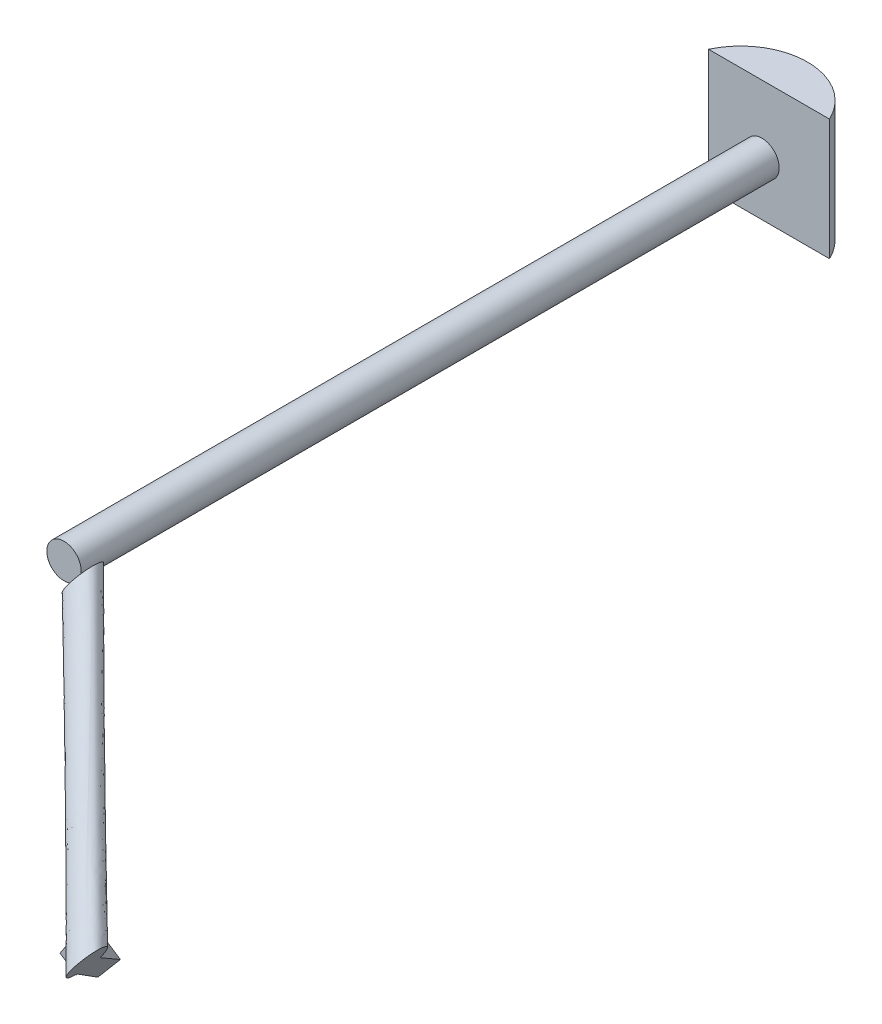
from build123d import *

# Parameters (mm, degrees)
BOSS_EXTRUDE1_DEPTH      = 58.596630013
BOSS_EXTRUDE1_DEPTH_BACK = 14.702178577
SKETCH1_R                = 1.802945267
BOSS_EXTRUDE2_DEPTH      = 6.35
BOSS_EXTRUDE4_DEPTH      = 2.032


with BuildPart() as part:
    # Sketch1 → Boss-Extrude1 (new, two sides: drawn at the far end of the back side and taken through both)
    with BuildSketch(Plane.XY.offset(-BOSS_EXTRUDE1_DEPTH_BACK)):
        Circle(SKETCH1_R)
    extrude(amount=BOSS_EXTRUDE1_DEPTH + BOSS_EXTRUDE1_DEPTH_BACK)


with BuildPart() as body_2:
    # Sketch2 → Boss-Extrude2 (new, symmetric)
    with BuildSketch(Plane(origin=(0, 0, -18.001846855), x_dir=(1, 0, 0), z_dir=(0, 1, 0))):
        with BuildLine():
            Line((-6.35, -2.563701192), (0, -2.563701192))
            Line((0, -2.563701192), (6.35, -2.563701192))
            ThreePointArc((6.35, -2.563701192), (0, 1.474189404), (-6.35, -2.563701192))
        make_face()
    extrude(amount=BOSS_EXTRUDE2_DEPTH, both=True)


with BuildPart() as body_3:
    # Loft1: read off the stored shape, not the designer's step
    # Loft1: loft between two sections, ruled curve by curve
    loft1_from = [
        Edge.make_bspline([(23.758910272, -13.385525744, 78.896242126), (23.758910272, -13.385525744, 78.73686213), (23.748236498, -13.401702223, 78.556571478), (23.685317405, -13.497058312, 78.164879199), (23.632510309, -13.577089315, 77.952712548), (23.463977025, -13.83250741, 77.544699757), (23.347053414, -14.009709237, 77.34987012), (23.055473338, -14.451609055, 77.067508327), (22.881132751, -14.715828321, 76.98368217), (22.530021742, -15.247949351, 76.98368217), (22.355681154, -15.512168617, 77.067508327), (22.064101078, -15.954068435, 77.34987012), (21.947177467, -16.131270262, 77.544699757), (21.778644183, -16.386688357, 77.952712548), (21.725837088, -16.46671936, 78.164879199), (21.662917995, -16.562075449, 78.556571478), (21.65224422, -16.578251928, 78.73686213), (21.65224422, -16.578251928, 79.055622122), (21.662917995, -16.562075449, 79.235912774), (21.725837088, -16.46671936, 79.627605053), (21.778644183, -16.386688357, 79.839771704), (21.947177467, -16.131270262, 80.247784495), (22.064101078, -15.954068435, 80.442614132), (22.355681154, -15.512168617, 80.724975925), (22.530021742, -15.247949351, 80.808802082), (22.881132751, -14.715828321, 80.808802082), (23.055473338, -14.451609055, 80.724975925), (23.347053414, -14.009709237, 80.442614132), (23.463977025, -13.83250741, 80.247784495), (23.632510309, -13.577089315, 79.839771704), (23.685317405, -13.497058312, 79.627605053), (23.748236498, -13.401702223, 79.235912774), (23.758910272, -13.385525744, 79.055622122), (23.758910272, -13.385525744, 78.896242126)], [0, 0, 0, 0, 0.0625, 0.0625, 0.125, 0.125, 0.1875, 0.1875, 0.25, 0.25, 0.3125, 0.3125, 0.375, 0.375, 0.4375, 0.4375, 0.5, 0.5, 0.5625, 0.5625, 0.625, 0.625, 0.6875, 0.6875, 0.75, 0.75, 0.8125, 0.8125, 0.875, 0.875, 0.9375, 0.9375, 1, 1, 1, 1], 3),
    ]
    loft1_to = [
        Edge.make_bspline([(2.353128009, 0.292600514, 56.97921639), (2.30108837, 0.213732618, 56.850866422), (2.233625455, 0.111490208, 56.717166863), (2.055063597, -0.159126542, 56.469464069), (1.943262459, -0.328565082, 56.355449486), (1.6743198, -0.736157101, 56.208293442), (1.516545887, -0.975268991, 56.17725956), (1.189539359, -1.470858837, 56.263746597), (1.02177118, -1.725117388, 56.383911953), (0.739018716, -2.15363865, 56.761870025), (0.625991196, -2.324935817, 57.017047112), (0.483374254, -2.541076787, 57.558310506), (0.452829155, -2.587368953, 57.84107231), (0.450329449, -2.591157347, 58.351068102), (0.477078646, -2.550618002, 58.578772473), (0.554302021, -2.433583272, 58.961935441), (0.604573586, -2.357394955, 59.11861485), (0.708652864, -2.199659164, 59.375314785), (0.776115778, -2.097416754, 59.509014344), (0.954677637, -1.826800004, 59.756717138), (1.066478775, -1.657361463, 59.870731722), (1.335421433, -1.249769445, 60.017887765), (1.493195346, -1.010657554, 60.048921647), (1.820201874, -0.515067708, 59.962434611), (1.987970053, -0.260809157, 59.842269254), (2.270722517, 0.167712105, 59.464311182), (2.383750038, 0.339009271, 59.209134095), (2.52636698, 0.555150241, 58.667870701), (2.556912078, 0.601442408, 58.385108897), (2.559411785, 0.605230801, 57.875113105), (2.532662588, 0.564691456, 57.647408734), (2.455439213, 0.447656726, 57.264245767), (2.405167648, 0.371468409, 57.107566358), (2.353128009, 0.292600514, 56.97921639)], [0, 0, 0, 0, 0.0625, 0.0625, 0.125, 0.125, 0.1875, 0.1875, 0.25, 0.25, 0.3125, 0.3125, 0.375, 0.375, 0.4375, 0.4375, 0.5, 0.5, 0.5625, 0.5625, 0.625, 0.625, 0.6875, 0.6875, 0.75, 0.75, 0.8125, 0.8125, 0.875, 0.875, 0.9375, 0.9375, 1, 1, 1, 1], 3),
    ]
    loft1 = Solid(Shell([*[Face.make_surface_from_curves(loft1_from[k], loft1_to[k]) for k in range(1)], Face(Wire(loft1_from)), Face(Wire(loft1_to))]))
    add(loft1)

    # Sketch8 → Boss-Extrude4 (add)
    with BuildSketch(Plane(origin=(22.705577246, -14.981888836, 0), x_dir=(0, 0, -1), z_dir=(0.8346734893476622, -0.5507451009134791, 0))):
        Polygon((-78.75825642, -2.050545662), (-73.982171856, -6.826630226), (-72.464389408, -5.308847777), (-76.921993148, -1.025272831), (-76.921993148, 0), (-78.896242126, 0), (-78.896242126, -2.050545662), align=None)
    extrude(amount=-BOSS_EXTRUDE4_DEPTH)


solid = Compound([part.part, body_2.part, body_3.part])
